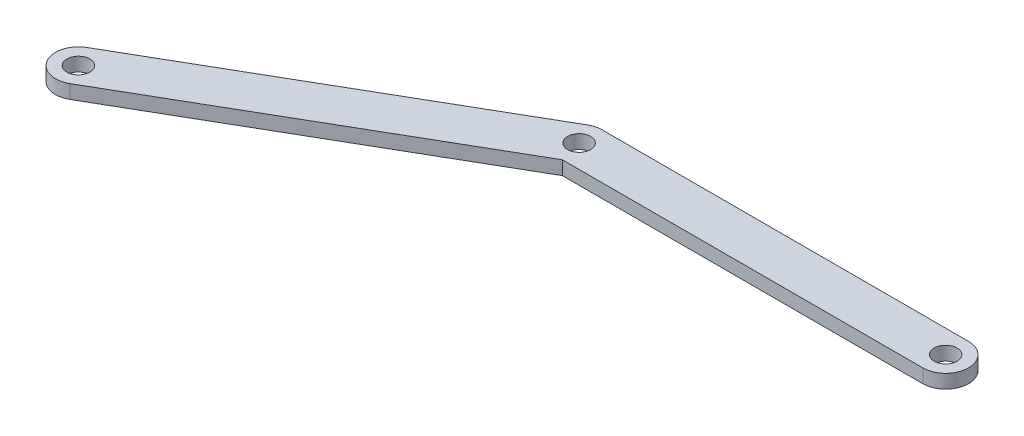
from build123d import *

# Parameters (mm, degrees)
SKETCH1_R               = 3.175
BOSS_EXTRUDE1_DEPTH     = 3.81
SKETCH2_R               = 3.175
BOSS_EXTRUDE2_DEPTH     = 3.81
CUT_EXTRUDE4_DEPTH      = 3.81
CUT_EXTRUDE4_DEPTH_BACK = 3.81
SKETCH1_2_R             = 3.175


with BuildPart() as part:
    # Sketch1 → Boss-Extrude1 (new body)
    with BuildSketch(Plane(origin=(0, 0, 0), x_dir=(1, 0, 0), z_dir=(0, 1, 0))):
        with BuildLine():
            Line((-50.8, 6.35), (50.8, 6.35))
            ThreePointArc((50.8, 6.35), (57.15, 0), (50.8, -6.35))
            Line((50.8, -6.35), (-50.8, -6.35))
            ThreePointArc((-50.8, -6.35), (-57.15, 0), (-50.8, 6.35))
        make_face()
        with Locations((-50.8, 0)):
            Circle(SKETCH1_R, mode=Mode.SUBTRACT)
        with Locations((50.8, 0)):
            Circle(SKETCH1_R, mode=Mode.SUBTRACT)
    extrude(amount=BOSS_EXTRUDE1_DEPTH)

    # Sketch2 → Boss-Extrude2 (add)
    with BuildSketch(Plane(origin=(0, 0, 0), x_dir=(1, 0, 0), z_dir=(0, 1, 0))):
        with BuildLine():
            Line((-141.963181024, -45.300738686), (-53.975, 5.499261314))
            ThreePointArc((-53.975, 5.499261314), (-45.300738686, 3.175), (-47.625, -5.499261314))
            Line((-47.625, -5.499261314), (-135.613181024, -56.299261314))
            ThreePointArc((-135.613181024, -56.299261314), (-144.287442339, -53.975), (-141.963181024, -45.300738686))
        make_face()
        with Locations((-138.788181024, -50.8)):
            Circle(SKETCH2_R, mode=Mode.SUBTRACT)
    extrude(amount=BOSS_EXTRUDE2_DEPTH)

    # Sketch1<2> → Cut-Extrude4 (cut, two sides: drawn at the far end of the back side and taken through both)
    with BuildSketch(Plane(origin=(0, 0, 0), x_dir=(1, 0, 0), z_dir=(0, 1, 0)).offset(-CUT_EXTRUDE4_DEPTH_BACK)):
        with Locations((-50.8, 0)):
            Circle(SKETCH1_2_R)
    extrude(amount=CUT_EXTRUDE4_DEPTH + CUT_EXTRUDE4_DEPTH_BACK, mode=Mode.SUBTRACT)


solid = part.part
